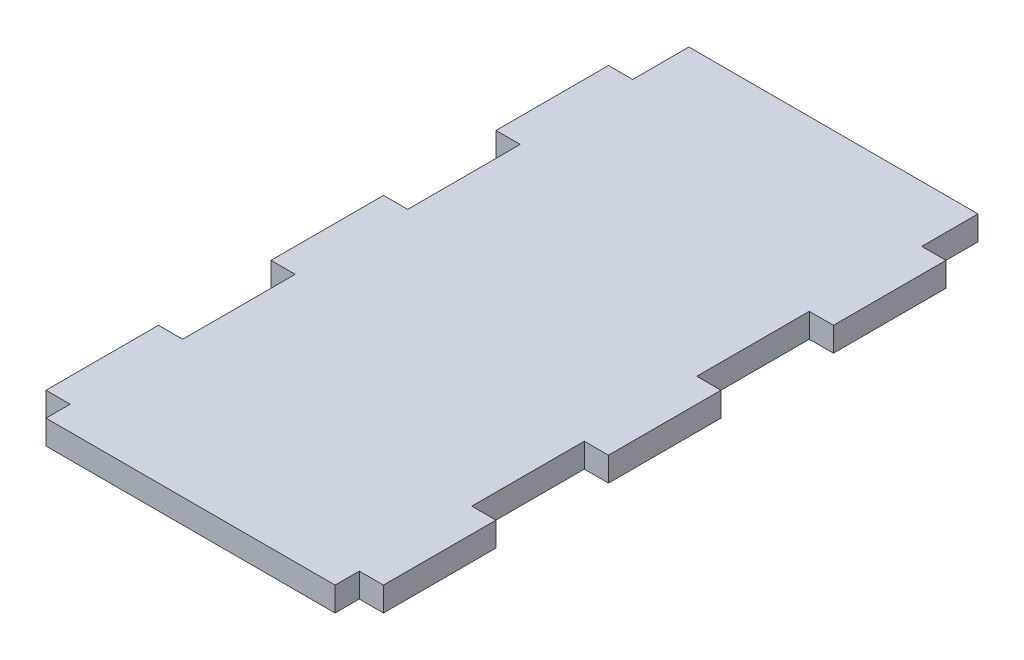
from build123d import *

# Parameters (mm, degrees)
SKETCH1_W           = 76.2
SKETCH1_H           = 127
BOSS_EXTRUDE1_DEPTH = 5.461
CAVITY1_START       = -38.1
CAVITY1_OUTLINE_W   = 5.461
CAVITY1_OUTLINE_H   = 25.4
CAVITY1_DEPTH       = 5.461
CAVITY1_START_2     = 32.639
CAVITY1_2_OUTLINE_W = 5.461
CAVITY1_2_OUTLINE_H = 25.4
CAVITY1_2_DEPTH     = 5.461
SKETCH2_W           = 65.278
SKETCH2_H           = 5.461
BOSS_EXTRUDE2_DEPTH = 5.461
SKETCH3_W           = 65.278
SKETCH3_H           = 5.461
BOSS_EXTRUDE3_DEPTH = 12.7


# Read off the part's stored shape, not the designer's step: Cavity1
with BuildPart() as part:
    # Sketch1 → Boss-Extrude1 (new body)
    with BuildSketch(Plane(origin=(0, 0, 0), x_dir=(1, 0, 0), z_dir=(0, 1, 0))):
        Rectangle(SKETCH1_W, SKETCH1_H)
    extrude(amount=BOSS_EXTRUDE1_DEPTH)

    # Cavity1 outline → Cavity1 (cut)
    with BuildSketch(Plane.YZ.offset(CAVITY1_START)):
        with Locations((2.7305, 25.4)):
            Rectangle(CAVITY1_OUTLINE_W, CAVITY1_OUTLINE_H)
        with Locations((2.7305, -25.4)):
            Rectangle(CAVITY1_OUTLINE_W, CAVITY1_OUTLINE_H)
    extrude(amount=CAVITY1_DEPTH, mode=Mode.SUBTRACT)

    # Cavity1 2 outline → Cavity1 2 (cut)
    with BuildSketch(Plane.YZ.offset(CAVITY1_START_2)):
        with Locations((2.7305, 25.4)):
            Rectangle(CAVITY1_2_OUTLINE_W, CAVITY1_2_OUTLINE_H)
        with Locations((2.7305, -25.4)):
            Rectangle(CAVITY1_2_OUTLINE_W, CAVITY1_2_OUTLINE_H)
    extrude(amount=CAVITY1_2_DEPTH, mode=Mode.SUBTRACT)

    # Sketch2 → Boss-Extrude2 (add)
    with BuildSketch(Plane.XY.offset(63.5)):
        with Locations((0, 2.7305)):
            Rectangle(SKETCH2_W, SKETCH2_H)
    extrude(amount=BOSS_EXTRUDE2_DEPTH)

    # Sketch3 → Boss-Extrude3 (add)
    with BuildSketch(Plane(origin=(0, 0, -63.5), x_dir=(-1, 0, 0), z_dir=(0, 0, -1))):
        with Locations((0, 2.7305)):
            Rectangle(SKETCH3_W, SKETCH3_H)
    extrude(amount=BOSS_EXTRUDE3_DEPTH)


solid = part.part
